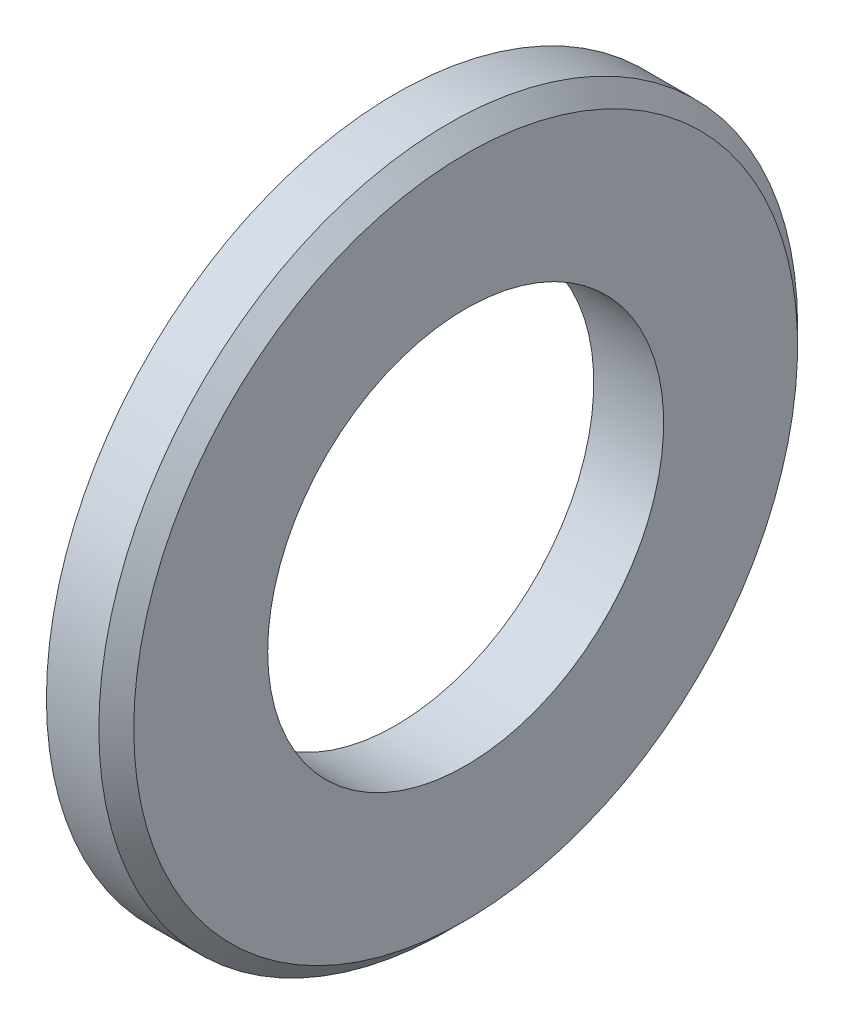
from build123d import *

# Parameters (mm, degrees)
SKETCH1_W      = 3
SKETCH1_H      = 6.5
ODCHAMFER_SIZE = 0.75


with BuildPart() as part:
    # Sketch1 → Base-Revolve (revolve)
    with BuildSketch(Plane.XY):
        with Locations((-1.5, 11.75)):
            Rectangle(SKETCH1_W, SKETCH1_H)
    revolve(axis=Axis((-34.925, 0, 0), (1, 0, 0)))

    # ODChamfer
    odchamfer_edges = [part.edges().sort_by_distance(p)[0] for p in [
        (0, -15, 0),
    ]]
    chamfer(odchamfer_edges, length=ODCHAMFER_SIZE)


solid = part.part
